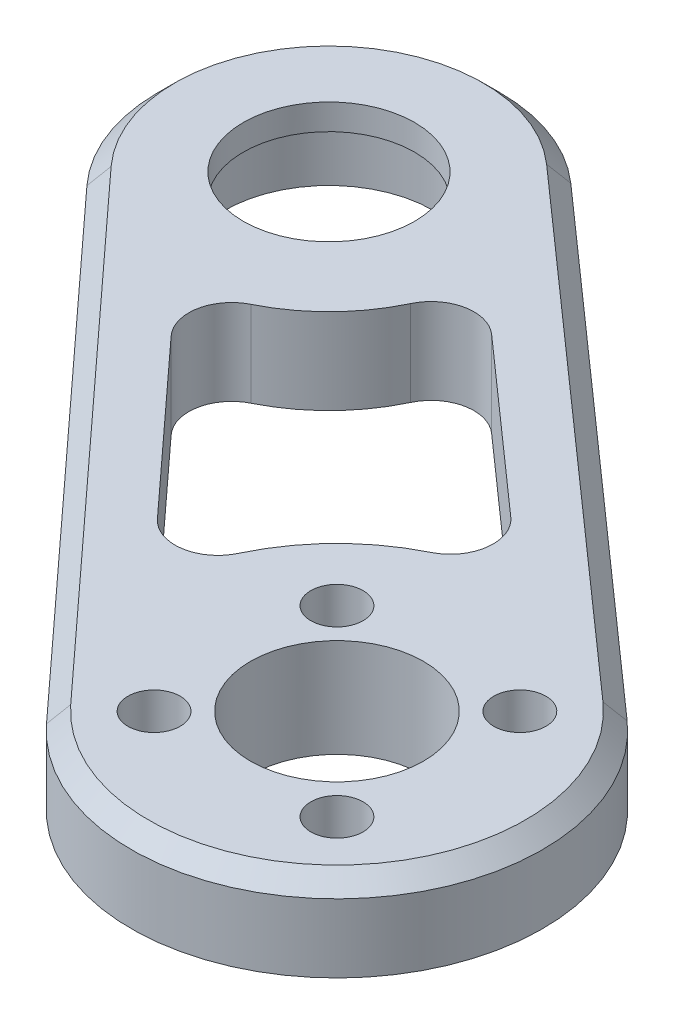
from build123d import *

# Parameters (mm, degrees)
SKETCH1_R              = 10.1
SKETCH1_R_2            = 10
MAIN_BODY_DEPTH        = 10
SKETCH2_R              = 12.2
BEARING_RECESS_DEPTH   = 7
STANDOFF_START         = 1.5
SKETCH3_R              = 21.5
SKETCH3_R_2            = 10.1
STANDOFF_SECTION_DEPTH = 1.5
SKETCH4_R              = 3.05
M6_BOLT_HOLES_DEPTH    = 107.03398004
CHAMFER1_SIZE          = 2


with BuildPart() as part:
    # Sketch1 → Main Body (new body)
    with BuildSketch(Plane(origin=(0, 0, 0), x_dir=(1, 0, 0), z_dir=(0, 1, 0))):
        with BuildLine():
            Line((-69.741518057, 40.551033083), (-17.689821668, -16.219439242))
            ThreePointArc((-17.689821668, -16.219439242), (17.115072934, -16.824811395), (15.914514265, 17.96463848))
            Line((15.914514265, 17.96463848), (-41.737904779, 69.037764518))
            ThreePointArc((-41.737904779, 69.037764518), (-69.262560778, 68.087908614), (-69.741518057, 40.551033083))
        make_face()
        Circle(SKETCH1_R, mode=Mode.SUBTRACT)
        with Locations((-55, 54.067232452)):
            Circle(SKETCH1_R_2, mode=Mode.SUBTRACT)
        with BuildLine():
            Line((-47.625471592, 28.267691162), (-29.927098797, 8.964862385))
            ThreePointArc((-29.927098797, 8.964862385), (-25.488644513, 7.400949716), (-21.717284924, 10.215651499))
            ThreePointArc((-21.717284924, 10.215651499), (-17.115072934, 16.824811395), (-10.585592312, 21.539388))
            ThreePointArc((-10.585592312, 21.539388), (-7.835804554, 25.358336357), (-9.475400239, 29.769393516))
            Line((-9.475400239, 29.769393516), (-29.078104388, 47.135037426))
            ThreePointArc((-29.078104388, 47.135037426), (-33.398420323, 48.290403264), (-36.914902554, 45.527370018))
            ThreePointArc((-36.914902554, 45.527370018), (-40.737439222, 40.046556289), (-46.152073662, 36.130839294))
            ThreePointArc((-46.152073662, 36.130839294), (-48.85455966, 32.56761471), (-47.625471592, 28.267691162))
        make_face(mode=Mode.SUBTRACT)
    extrude(amount=MAIN_BODY_DEPTH)

    # Sketch2 → Bearing Recess (cut)
    with BuildSketch(Plane.XZ):
        with Locations((-55, -54.067232452)):
            Circle(SKETCH2_R)
    extrude(amount=-BEARING_RECESS_DEPTH, mode=Mode.SUBTRACT)

    # Sketch3 → Standoff Section (add)
    with BuildSketch(Plane.XZ.offset(STANDOFF_START)):
        Circle(SKETCH3_R)
        Circle(SKETCH3_R_2, mode=Mode.SUBTRACT)
    extrude(amount=-STANDOFF_SECTION_DEPTH)

    # Sketch4 → M6 Bolt holes (cut, through all)
    with BuildSketch(Plane.XZ.offset(1.5)):
        with Locations((-10.677312396, 10.677312396)):
            Circle(SKETCH4_R)
        with Locations((10.677312396, 10.677312396)):
            Circle(SKETCH4_R)
        with Locations((10.677312396, -10.677312396)):
            Circle(SKETCH4_R)
        with Locations((-10.677312396, -10.677312396)):
            Circle(SKETCH4_R)
    extrude(amount=-M6_BOLT_HOLES_DEPTH, mode=Mode.SUBTRACT)

    # Chamfer1
    chamfer1_edges = [part.edges().sort_by_distance(p)[0] for p in [
        (17.115072934, 10, 16.824811395),
        (-12.911695257, 10, -43.501201499),
        (-43.715669863, 10, -12.16579692),
        (-69.262560778, 10, -68.087908614),
    ]]
    chamfer(chamfer1_edges, length=CHAMFER1_SIZE)


solid = part.part
